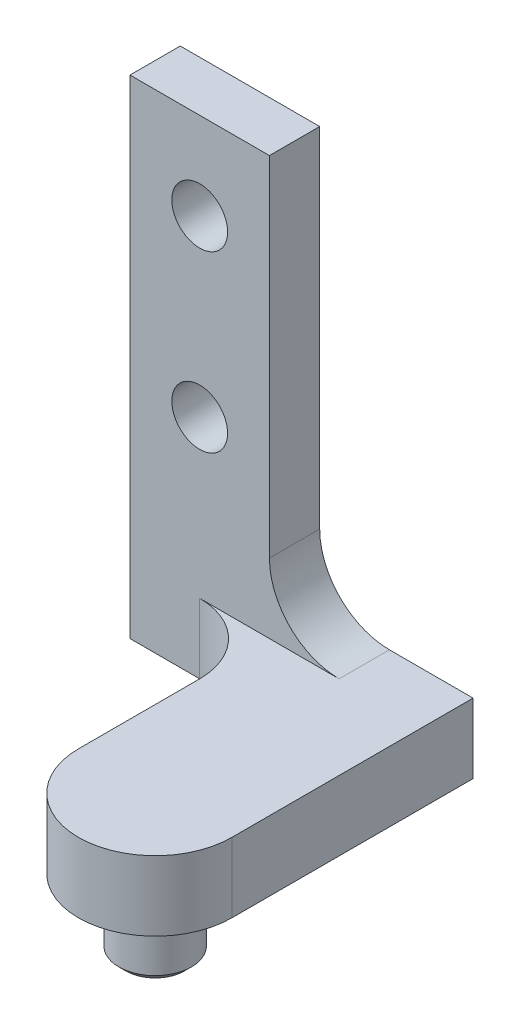
from build123d import *

# Parameters (mm, degrees)
BOSS_EXTRUDE1_DEPTH = 5
SKETCH1_3_R         = 2.6
BOSS_EXTRUDE2_DEPTH = 5
CHAMFER1_SIZE       = 0.5
FILLET2_R           = 1
SKETCH4_W           = 10
SKETCH4_H           = 3.606764246
BOSS_EXTRUDE4_DEPTH = 35
FILLET4_R           = 5
FILLET5_R           = 5
SKETCH5_R           = 2
CUT_EXTRUDE2_DEPTH  = 35


with BuildPart() as part:
    # Sketch1 → Boss-Extrude1 (new body)
    with BuildSketch(Plane(origin=(0, 0, 0), x_dir=(1, 0, 0), z_dir=(0, 1, 0))):
        with BuildLine():
            ThreePointArc((-21.596264894, -4.61112093), (-16.096264894, -10.11112093), (-10.596264894, -4.61112093))
            Line((-10.596264894, -4.61112093), (-10.596264894, 12.68887907))
            Line((-10.596264894, 12.68887907), (-21.596264894, 12.68887907))
            Line((-21.596264894, 12.68887907), (-21.596264894, -4.61112093))
        make_face()
    extrude(amount=BOSS_EXTRUDE1_DEPTH)

    # Sketch1<3> → Boss-Extrude2 (add)
    with BuildSketch(Plane(origin=(0, 0, 0), x_dir=(1, 0, 0), z_dir=(0, 1, 0))):
        with Locations((-16.096264894, -4.61112093)):
            Circle(SKETCH1_3_R)
    extrude(amount=-BOSS_EXTRUDE2_DEPTH)

    # Chamfer1
    chamfer1_edges = [part.edges().sort_by_distance(p)[0] for p in [
        (-18.696264894, -5, 4.61112093),
    ]]
    chamfer(chamfer1_edges, length=CHAMFER1_SIZE)

    # Fillet2
    fillet2_edges = [part.edges().sort_by_distance(p)[0] for p in [
        (-18.696264894, 0, 4.61112093),
    ]]
    fillet(fillet2_edges, radius=FILLET2_R)

    # Sketch4 → Boss-Extrude4 (add)
    with BuildSketch(Plane.XZ):
        with Locations((-26.596264894, -10.885496947)):
            Rectangle(SKETCH4_W, SKETCH4_H)
    extrude(amount=-BOSS_EXTRUDE4_DEPTH)

    # Fillet4
    fillet4_edges = [part.edges().sort_by_distance(p)[0] for p in [
        (-21.596264894, 2.5, -9.082114824),
    ]]
    fillet(fillet4_edges, radius=FILLET4_R)

    # Fillet5
    fillet5_edges = [part.edges().sort_by_distance(p)[0] for p in [
        (-21.596264894, 5, -10.885496947),
    ]]
    fillet(fillet5_edges, radius=FILLET5_R)

    # Sketch5 → Cut-Extrude2 (cut)
    with BuildSketch(Plane.XY.offset(-9.082114824)):
        with Locations((-26.596264894, 28.75)):
            Circle(SKETCH5_R)
        with Locations((-26.596264894, 16.25)):
            Circle(SKETCH5_R)
    extrude(amount=-CUT_EXTRUDE2_DEPTH, mode=Mode.SUBTRACT)


solid = part.part
